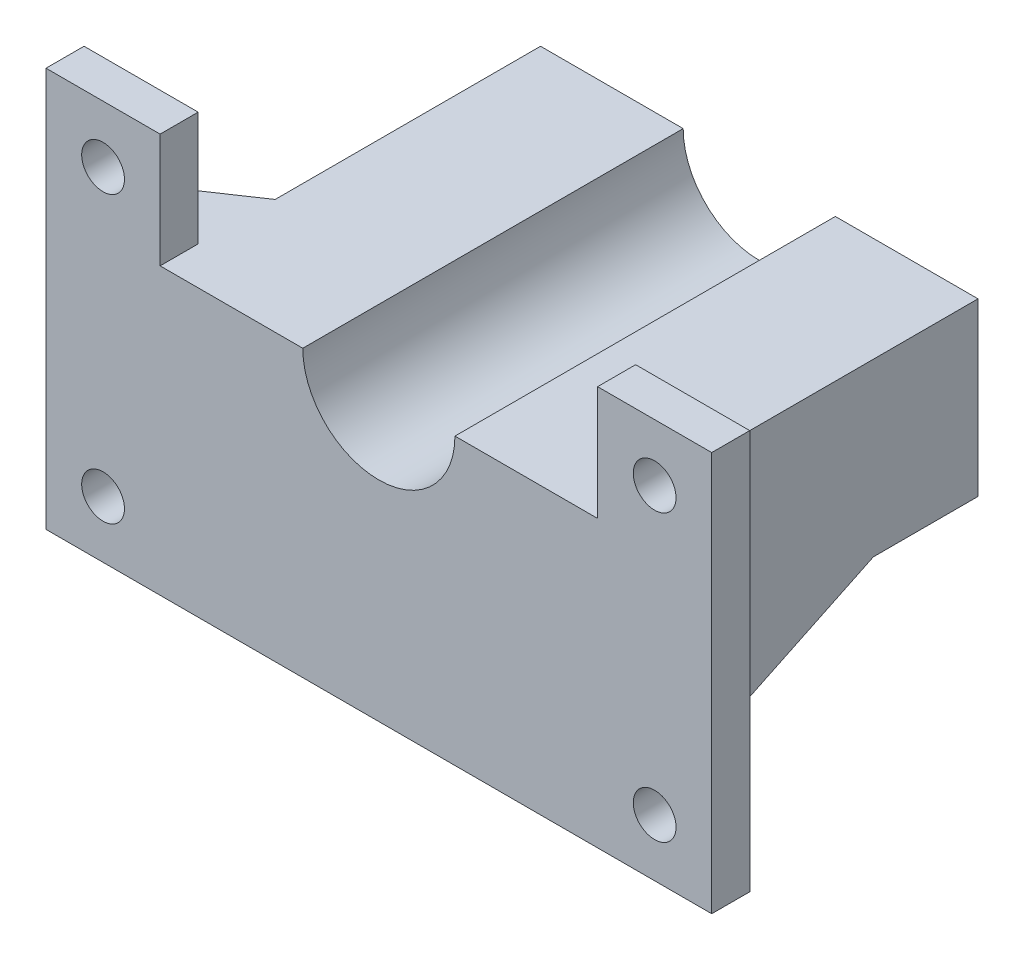
from build123d import *

# Parameters (mm, degrees)
ESTRUSIONE_ESTRUSIONE1_DEPTH                         = 4
ESTRUSIONE_ESTRUSIONE2_START                         = -36
ESTRUSIONE_ESTRUSIONE2_DEPTH                         = 36
ESTRUSIONE_ESTRUSIONE3_START                         = -46
ESTRUSIONE_ESTRUSIONE3_DEPTH                         = 46
SMUSSO3_SIZE                                         = 8.0941
SMUSSO3_SIZE2                                        = 11.999996735
SMUSSO2_SIZE                                         = 8.0941
SMUSSO2_SIZE_2                                       = 11.999996735
FORO_LAMATO_PER_VITE_M4_A_TESTA_CILINDRI_D           = 4.5
FORO_LAMATO_PER_VITE_M4_A_TESTA_CILINDRI_DEPTH       = 50
FORO_LAMATO_PER_VITE_M4_A_TESTA_CILINDRI_CBORE_D     = 8
FORO_LAMATO_PER_VITE_M4_A_TESTA_CILINDRI_CBORE_DEPTH = 35.6
FORO_LAMATO_PER_VITE_M4_A_TESTA_CILINDRI_TIP         = 1.351936393
FORO_PER_VITE_M4_1_D                                 = 4.5
FORO_PER_VITE_M4_1_DEPTH                             = 50
FORO_PER_VITE_M4_1_TIP                               = 1.351936393


with BuildPart() as part:
    # Schizzo1 → Estrusione-Estrusione1 (new body)
    with BuildSketch(Plane.XY):
        Polygon((35, 30), (23, 30), (23, 18), (23, 0), (-23, 0), (-23, 18), (-23, 30), (-35, 30), (-35, -12), (35, -12), align=None)
        with BuildLine():
            ThreePointArc((-8, 18), (0, 10), (8, 18))
            Line((8, 18), (23, 18))
            Line((23, 18), (23, 0))
            Line((23, 0), (-23, 0))
            Line((-23, 0), (-23, 18))
            Line((-23, 18), (-8, 18))
        make_face()
    extrude(amount=ESTRUSIONE_ESTRUSIONE1_DEPTH)

    # Schizzo1<3> → Estrusione-Estrusione2 (add)
    with BuildSketch(Plane.XY.offset(ESTRUSIONE_ESTRUSIONE2_START)):
        with BuildLine():
            ThreePointArc((-8, 18), (0, 10), (8, 18))
            Line((8, 18), (23, 18))
            Line((23, 18), (23, 0))
            Line((23, 0), (-23, 0))
            Line((-23, 0), (-23, 18))
            Line((-23, 18), (-8, 18))
        make_face()
    extrude(amount=ESTRUSIONE_ESTRUSIONE2_DEPTH)

    # Schizzo6 → Estrusione-Estrusione3 (add)
    with BuildSketch(Plane(origin=(23, 0, 0), x_dir=(0, 0, -1), z_dir=(1, 0, 0)).offset(ESTRUSIONE_ESTRUSIONE3_START)):
        Polygon((0, 0), (25, 0), (0, -12), align=None)
    extrude(amount=ESTRUSIONE_ESTRUSIONE3_DEPTH)

    # Smusso3
    smusso3_edges = [part.edges().sort_by_distance(p)[0] for p in [
        (-23, 3, 0),
    ]]
    smusso3_side = [part.faces().sort_by_distance(p)[0] for p in [
        (-23, 6.556390977, -16.182957393),
    ]]
    chamfer(smusso3_edges, length=SMUSSO3_SIZE, length2=SMUSSO3_SIZE2, reference=smusso3_side[0])

    # Smusso2
    # the kernel refuses this chamfer: 11.999996735, 8.0941 mm, written as the material it adds along each edge
    with BuildSketch(Plane(origin=(23, -43.002099643, 0), x_dir=(-0.047532142988028575, 0, -0.9988697089125115), z_dir=(0, 1, 0))) as smusso2_piece_1_section:
        Polygon((SMUSSO2_SIZE * 0.998869708913, -SMUSSO2_SIZE * 0.047532142988), (-SMUSSO2_SIZE_2 * 0.047532142989, -SMUSSO2_SIZE_2 * 0.998869708932), (0, 0), align=None)
    smusso2_piece_1 = extrude(amount=61.002099643, mode=Mode.PRIVATE)
    smusso2_piece_1 = split(smusso2_piece_1, bisect_by=Plane(origin=(27.04511503, -8.043833676, -8.242013176), z_dir=(0, 0.9015230574682735, 0.4327310675847713)), keep=Keep.TOP, mode=Mode.PRIVATE)
    add(smusso2_piece_1)

    # Foro lamato per Vite M4 a testa cilindrica piana-1
    with Locations(Plane(origin=(0, 0, -36), x_dir=(-1, 0, 0), z_dir=(0, 0, -1))):
        with Locations((-29, -6), (28.999998368, -6)):
            CounterBoreHole(FORO_LAMATO_PER_VITE_M4_A_TESTA_CILINDRI_D / 2, FORO_LAMATO_PER_VITE_M4_A_TESTA_CILINDRI_CBORE_D / 2, FORO_LAMATO_PER_VITE_M4_A_TESTA_CILINDRI_CBORE_DEPTH, depth=FORO_LAMATO_PER_VITE_M4_A_TESTA_CILINDRI_DEPTH)
            with Locations((0, 0, -(FORO_LAMATO_PER_VITE_M4_A_TESTA_CILINDRI_DEPTH + FORO_LAMATO_PER_VITE_M4_A_TESTA_CILINDRI_TIP / 2))):  # 118° drill point
                Cone(0, FORO_LAMATO_PER_VITE_M4_A_TESTA_CILINDRI_D / 2, FORO_LAMATO_PER_VITE_M4_A_TESTA_CILINDRI_TIP, mode=Mode.SUBTRACT)

    # Foro per Vite M4-1
    with Locations(Plane(origin=(29, 24, 0), x_dir=(-1, 0, 0), z_dir=(0, 0, -1))):
        with Locations((0, 0), (58, 0)):
            Hole(FORO_PER_VITE_M4_1_D / 2, depth=FORO_PER_VITE_M4_1_DEPTH)
            with Locations((0, 0, -(FORO_PER_VITE_M4_1_DEPTH + FORO_PER_VITE_M4_1_TIP / 2))):  # 118° drill point
                Cone(0, FORO_PER_VITE_M4_1_D / 2, FORO_PER_VITE_M4_1_TIP, mode=Mode.SUBTRACT)


solid = part.part
